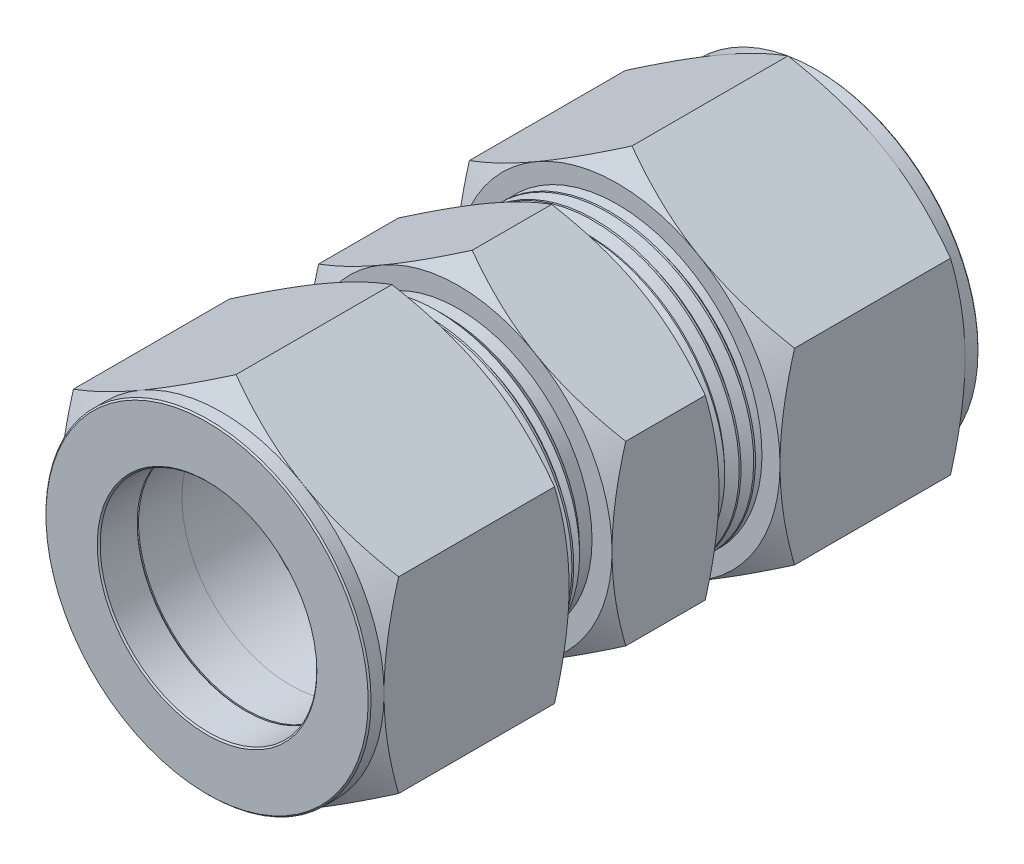
from build123d import *

# Parameters (mm, degrees)
BOSS_EXTRUDE1_DEPTH = 17.526
CHAMFER1_SIZE       = 0.127
SKETCH4_W           = 16.637
SKETCH4_H           = 12.7
CUT_SWEEP1_PITCH    = 1.27
BOSS_EXTRUDE2_DEPTH = 4.699
CIRPATTERN1_COUNT   = 2


with BuildPart() as part:
    # Sketch2 → Boss-Extrude1 (new body)
    with BuildSketch(Plane.XY):
        Polygon((0, 16.497783942), (-14.2875, 8.248891971), (-14.2875, -8.248891971), (0, -16.497783942), (14.2875, -8.248891971), (14.2875, 8.248891971), align=None)
    extrude(amount=-BOSS_EXTRUDE1_DEPTH)

    # Sketch3 → Cut-Revolve1 (revolve, cut)
    with BuildSketch(Plane(origin=(0, 0, 0), x_dir=(0, 0, -1), z_dir=(1, 0, 0)), mode=Mode.PRIVATE) as cut_revolve1_sk:
        Polygon((0, 16.497783942), (0, 14.2875), (1.27, 14.2875), (2.546108029, 16.497783942), (16.249891971, 16.497783942), (17.526, 14.2875), (17.526, 16.497783942), (17.526, 18.708067884), (0, 18.708067884), align=None)
        Polygon((0, 9.525), (0, 0), (17.526, 0), (17.526, 12.7), (7.0104, 12.7), (7.0104, 12.065), (3.5052, 12.065), (3.5052, 11.43), (3.5052, 9.525), align=None)
    revolve(cut_revolve1_sk.sketch.rotate(Axis((0, 0, 0), (0, 0, -1)), 180), axis=Axis((0, 0, 0), (0, 0, -1)), mode=Mode.SUBTRACT)

    # Chamfer1
    chamfer1_edges = [part.edges().sort_by_distance(p)[0] for p in [
        (0, 14.2875, 0),
        (0, 9.525, -3.5052),
        (0, 9.525, 0),
    ]]
    chamfer(chamfer1_edges, length=CHAMFER1_SIZE)


with BuildPart() as body_2:
    # Sketch4 → Revolve1 (revolve)
    with BuildSketch(Plane(origin=(0, 0, 0), x_dir=(0, 0, -1), z_dir=(1, 0, 0))):
        with Locations((18.4785, 6.35)):
            Rectangle(SKETCH4_W, SKETCH4_H)
    revolve(axis=Axis((0, 0, -26.797), (0, 0, 1)))

    # Cut-Sweep1: the profile of Sketch6 screwed along a right-hand helix of 14.1 turns, 8 arcs to a turn; built about Z, then put on its axis
    cut_sweep1_z = Axis((0, 0, 0), (0, 0, 1))
    cut_sweep1_corners = [(11.875110803, 0, -0.635), (12.768740766, 0, -1.1509375), (12.768740766, 0, 0.0396875), (11.875110803, 0, -0.47625)]
    with BuildLine(mode=Mode.PRIVATE) as cut_sweep1_profile:
        Line(cut_sweep1_corners[0], cut_sweep1_corners[1])
        Line(cut_sweep1_corners[1], cut_sweep1_corners[2])
        Line(cut_sweep1_corners[2], cut_sweep1_corners[3])
        Line(cut_sweep1_corners[3], cut_sweep1_corners[0])
    cut_sweep1_cap = Face(cut_sweep1_profile.wire())
    cut_sweep1_turn_angles = [0, 22.5, 45, 67.5, 90, 112.5, 135, 157.5, 180, 202.5, 225, 247.5, 270, 292.5, 315, 337.5, 360]
    cut_sweep1_turn_weights = [1, 0.9238795325112867, 1, 0.9238795325112867, 1, 0.9238795325112867, 1, 0.9238795325112867, 1, 0.9238795325112867, 1, 0.9238795325112867, 1, 0.9238795325112867, 1, 0.9238795325112867, 1]
    cut_sweep1_turn_rails = [Edge.make_bspline([Vector(p[0], p[1], 0).rotate(cut_sweep1_z, cut_sweep1_turn_angles[k]) / cut_sweep1_turn_weights[k] + Vector(0, 0, p[2] + CUT_SWEEP1_PITCH * cut_sweep1_turn_angles[k] / 360) for k in range(17)], [0, 0, 0, 1, 1, 2, 2, 3, 3, 4, 4, 5, 5, 6, 6, 7, 7, 8, 8, 8], 2, cut_sweep1_turn_weights) for p in cut_sweep1_corners]
    cut_sweep1_turn_sides = [Face.make_surface_from_curves(cut_sweep1_turn_rails[p[0]], cut_sweep1_turn_rails[p[1]]) for p in [(0, 1), (1, 2), (2, 3), (3, 0)]]
    cut_sweep1_last_angles = [5040, 5058, 5076]
    cut_sweep1_last_weights = [1, 0.9510565162951634, 1]
    cut_sweep1_last_rails = [Edge.make_bspline([Vector(p[0], p[1], 0).rotate(cut_sweep1_z, cut_sweep1_last_angles[k]) / cut_sweep1_last_weights[k] + Vector(0, 0, p[2] + CUT_SWEEP1_PITCH * cut_sweep1_last_angles[k] / 360) for k in range(3)], [0, 0, 0, 1, 1, 1], 2, cut_sweep1_last_weights) for p in cut_sweep1_corners]
    cut_sweep1_last_sides = [Face.make_surface_from_curves(cut_sweep1_last_rails[p[0]], cut_sweep1_last_rails[p[1]]) for p in [(0, 1), (1, 2), (2, 3), (3, 0)]]
    cut_sweep1 = Plane(origin=(0, 0, -10.16), x_dir=(0, 1, 0), z_dir=(0, 0, -1)) * Solid(Shell([*[p.moved(Location((0, 0, CUT_SWEEP1_PITCH * i))) for i in range(14) for p in cut_sweep1_turn_sides], *cut_sweep1_last_sides, cut_sweep1_cap, cut_sweep1_cap.rotate(cut_sweep1_z, 5076).moved(Location((0, 0, CUT_SWEEP1_PITCH * 5076 / 360)))]))
    add(cut_sweep1, mode=Mode.SUBTRACT)

    # Sketch7 → Boss-Extrude2 (add)
    with BuildSketch(Plane(origin=(0, 0, -26.797), x_dir=(-1, 0, 0), z_dir=(0, 0, -1))):
        Polygon((0, 15.58124039), (-13.49375, 7.790620195), (-13.49375, -7.790620195), (0, -15.58124039), (13.49375, -7.790620195), (13.49375, 7.790620195), align=None)
    extrude(amount=-BOSS_EXTRUDE2_DEPTH)

    # Sketch8 → Cut-Revolve2 (revolve, cut)
    with BuildSketch(Plane(origin=(0, 0, 0), x_dir=(0, 0, -1), z_dir=(1, 0, 0)), mode=Mode.PRIVATE) as cut_revolve2_sk:
        Polygon((10.16, 12.837481533), (10.16, 11.73762927), (11.259852263, 12.837481533), align=None)
        Polygon((22.098, 12.837481533), (19.898295474, 12.837481533), (20.998147737, 11.73762927), (22.098, 11.73762927), align=None)
        Polygon((22.098, 13.49375), (23.303213138, 15.58124039), (26.797, 15.58124039), (26.797, 17.66873078), (22.098, 17.66873078), (22.098, 15.58124039), align=None)
        Polygon((24.384, 7.9375), (26.797, 7.9375), (26.797, 0), (10.16, 0), (10.16, 10.873316667), (15.70736, 9.525), (24.384, 9.525), align=None)
    revolve(cut_revolve2_sk.sketch.rotate(Axis((0, 0, 0), (0, 0, -1)), 180), axis=Axis((0, 0, 0), (0, 0, -1)), mode=Mode.SUBTRACT)


with BuildPart() as body_3:
    # Sketch9 → Revolve2 (revolve)
    with BuildSketch(Plane(origin=(0, 0, 0), x_dir=(0, 0, -1), z_dir=(1, 0, 0)), mode=Mode.PRIVATE) as revolve2_sk:
        Polygon((6.1976, 11.8364), (6.1976, 10.6426), (7.3152, 9.525), (13.5128, 9.525), (13.5128, 10.0584), align=None)
    revolve(revolve2_sk.sketch.rotate(Axis((0, 0, 0), (0, 0, -1)), 180), axis=Axis((0, 0, 0), (0, 0, -1)))


with BuildPart() as body_4:
    # Sketch10 → Revolve3 (revolve)
    with BuildSketch(Plane(origin=(0, 0, 0), x_dir=(0, 0, -1), z_dir=(1, 0, 0)), mode=Mode.PRIVATE) as revolve3_sk:
        Polygon((3.5052, 11.0363), (4.7752, 11.0363), (4.7752, 10.6426), (6.1976, 10.6426), (7.3152, 9.525), (3.5052, 9.525), align=None)
    revolve(revolve3_sk.sketch.rotate(Axis((0, 0, 0), (0, 0, -1)), 180), axis=Axis((0, 0, 0), (0, 0, -1)))


with BuildPart() as cirpattern1_1:
    # CirPattern1: pattern copy
    add(body_2.part.rotate(Axis((0, 0, -26.797), (1, 0, 0)), 1 * 360 / CIRPATTERN1_COUNT))

    # Combine1: union body 2
    add(body_2.part)


with BuildPart() as cirpattern1_2:
    # CirPattern1: pattern copy
    add(part.part.rotate(Axis((0, 0, -26.797), (1, 0, 0)), 1 * 360 / CIRPATTERN1_COUNT))


with BuildPart() as cirpattern1_3:
    # CirPattern1: pattern copy
    add(body_4.part.rotate(Axis((0, 0, -26.797), (1, 0, 0)), 1 * 360 / CIRPATTERN1_COUNT))


with BuildPart() as cirpattern1_4:
    # CirPattern1: pattern copy
    add(body_3.part.rotate(Axis((0, 0, -26.797), (1, 0, 0)), 1 * 360 / CIRPATTERN1_COUNT))


solid = Compound([part.part, body_3.part, body_4.part, cirpattern1_1.part, cirpattern1_2.part, cirpattern1_3.part, cirpattern1_4.part])
